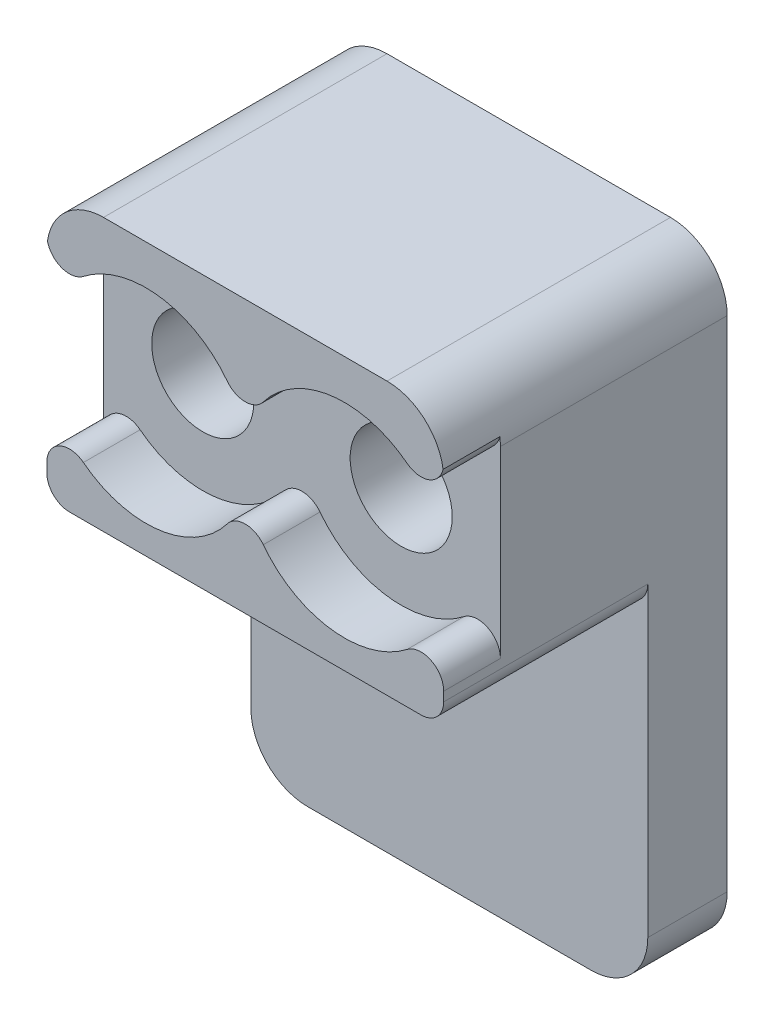
from build123d import *

# Parameters (mm, degrees)
BOSS_EXTRUDE1_DEPTH = 17.78
SKETCH2_R           = 2.286
CUT_EXTRUDE1_DEPTH  = 36.070400967
SKETCH3_R           = 2.286
SKETCH3_R_2         = 4.572
CUT_EXTRUDE2_DEPTH  = 2.54
FILLET1_R           = 1.016
FILLET2_R           = 2.54


with BuildPart() as part:
    # Sketch1 → Boss-Extrude1 (new body)
    with BuildSketch(Plane(origin=(0, 0, 0), x_dir=(0, 0, -1), z_dir=(1, 0, 0))):
        Polygon((0, 0), (0, 27.432), (-12.7, 27.432), (-12.7, 15.24), (-3.556, 15.24), (-3.556, 0), align=None)
    extrude(amount=BOSS_EXTRUDE1_DEPTH)

    # Sketch2 → Cut-Extrude1 (cut, through all)
    with BuildSketch(Plane.XY.offset(12.7)):
        with Locations((4.445, 21.082)):
            Circle(SKETCH2_R)
        with Locations(Location((13.335, 21.082, 0), (0, 0, 180))):
            Circle(SKETCH2_R)
    extrude(amount=-CUT_EXTRUDE1_DEPTH, mode=Mode.SUBTRACT)

    # Sketch3 → Cut-Extrude2 (cut)
    # profile 1 of 4: a face of its own
    with BuildSketch(Plane.XY.offset(12.7)):
        with BuildLine():
            ThreePointArc((8.89, 20.011878979), (8.763, 21.082), (8.89, 22.152121021))
            ThreePointArc((8.89, 22.152121021), (4.445, 25.654), (0, 22.152121021))
            Line((0, 22.152121021), (0, 20.011878979))
            ThreePointArc((0, 20.011878979), (4.445, 16.51), (8.89, 20.011878979))
        make_face()
        with Locations((4.445, 21.082)):
            Circle(SKETCH3_R, mode=Mode.SUBTRACT)
    # profile 2 of 4: a face of its own
    with BuildSketch(Plane.XY.offset(12.7)):
        with BuildLine():
            ThreePointArc((8.89, 22.152121021), (8.985138985, 21.620815367), (9.017, 21.082))
            ThreePointArc((9.017, 21.082), (8.985138985, 20.543184633), (8.89, 20.011878979))
            ThreePointArc((8.89, 20.011878979), (13.335, 16.51), (17.78, 20.011878979))
            Line((17.78, 20.011878979), (17.78, 22.152121021))
            ThreePointArc((17.78, 22.152121021), (13.335, 25.654), (8.89, 22.152121021))
        make_face()
        with Locations((13.335, 21.082)):
            Circle(SKETCH3_R, mode=Mode.SUBTRACT)
    # profile 3 of 4: a face of its own
    with BuildSketch(Plane.XY.offset(12.7)):
        with Locations((4.445, 21.082)):
            Circle(SKETCH3_R_2)
    # profile 4 of 4: a face of its own
    with BuildSketch(Plane.XY.offset(12.7)):
        with Locations((13.335, 21.082)):
            Circle(SKETCH3_R_2)
    extrude(amount=-CUT_EXTRUDE2_DEPTH, mode=Mode.SUBTRACT)

    # Fillet1
    fillet1_edges = [part.edges().sort_by_distance(p)[0] for p in [
        (17.78, 15.24, 8.128),
        (8.89, 20.011878979, 11.43),
        (0, 20.011878979, 11.43),
        (0, 22.152121021, 11.43),
        (8.89, 22.152121021, 11.43),
        (17.78, 22.152121021, 11.43),
        (17.78, 20.011878979, 11.43),
        (0, 15.24, 8.128),
    ]]
    fillet(fillet1_edges, radius=FILLET1_R)

    # Fillet2
    # the kernel refuses this fillet: 2.54 mm, written as the material it takes off along each edge
    with BuildSketch(Plane(origin=(0, 27.432, -6.35), x_dir=(0, -1, 0), z_dir=(0, 0, 1))) as fillet2_piece_1:
        with BuildLine():
            CenterArc((FILLET2_R, FILLET2_R), FILLET2_R, 180, 90)
            Line((0, FILLET2_R), (-FILLET2_R * 0.02, FILLET2_R))
            Line((-FILLET2_R * 0.02, FILLET2_R), (-FILLET2_R * 0.02, -FILLET2_R * 0.02))
            Line((-FILLET2_R * 0.02, -FILLET2_R * 0.02), (FILLET2_R, -FILLET2_R * 0.02))
            Line((FILLET2_R, -FILLET2_R * 0.02), (FILLET2_R, 0))
        make_face()
    extrude(amount=25.4, mode=Mode.SUBTRACT)
    with BuildSketch(Plane(origin=(17.78, 27.432, -6.35), x_dir=(0, -1, 0), z_dir=(0, 0, 1))) as fillet2_piece_2:
        with BuildLine():
            CenterArc((FILLET2_R, -FILLET2_R), FILLET2_R, 90, 90)
            Line((0, -FILLET2_R), (-FILLET2_R * 0.02, -FILLET2_R))
            Line((-FILLET2_R * 0.02, -FILLET2_R), (-FILLET2_R * 0.02, FILLET2_R * 0.02))
            Line((-FILLET2_R * 0.02, FILLET2_R * 0.02), (FILLET2_R, FILLET2_R * 0.02))
            Line((FILLET2_R, FILLET2_R * 0.02), (FILLET2_R, 0))
        make_face()
    extrude(amount=25.4, mode=Mode.SUBTRACT)
    with BuildSketch(Plane(origin=(0, 0, 9.906), x_dir=(0, 1, 0), z_dir=(0, 0, -1))) as fillet2_piece_3:
        with BuildLine():
            CenterArc((FILLET2_R, FILLET2_R), FILLET2_R, 180, 90)
            Line((0, FILLET2_R), (-FILLET2_R * 0.02, FILLET2_R))
            Line((-FILLET2_R * 0.02, FILLET2_R), (-FILLET2_R * 0.02, -FILLET2_R * 0.02))
            Line((-FILLET2_R * 0.02, -FILLET2_R * 0.02), (FILLET2_R, -FILLET2_R * 0.02))
            Line((FILLET2_R, -FILLET2_R * 0.02), (FILLET2_R, 0))
        make_face()
    extrude(amount=16.256, mode=Mode.SUBTRACT)
    with BuildSketch(Plane(origin=(17.78, 0, 9.906), x_dir=(0, 1, 0), z_dir=(0, 0, -1))) as fillet2_piece_4:
        with BuildLine():
            CenterArc((FILLET2_R, -FILLET2_R), FILLET2_R, 90, 90)
            Line((0, -FILLET2_R), (-FILLET2_R * 0.02, -FILLET2_R))
            Line((-FILLET2_R * 0.02, -FILLET2_R), (-FILLET2_R * 0.02, FILLET2_R * 0.02))
            Line((-FILLET2_R * 0.02, FILLET2_R * 0.02), (FILLET2_R, FILLET2_R * 0.02))
            Line((FILLET2_R, FILLET2_R * 0.02), (FILLET2_R, 0))
        make_face()
    extrude(amount=16.256, mode=Mode.SUBTRACT)


solid = part.part
